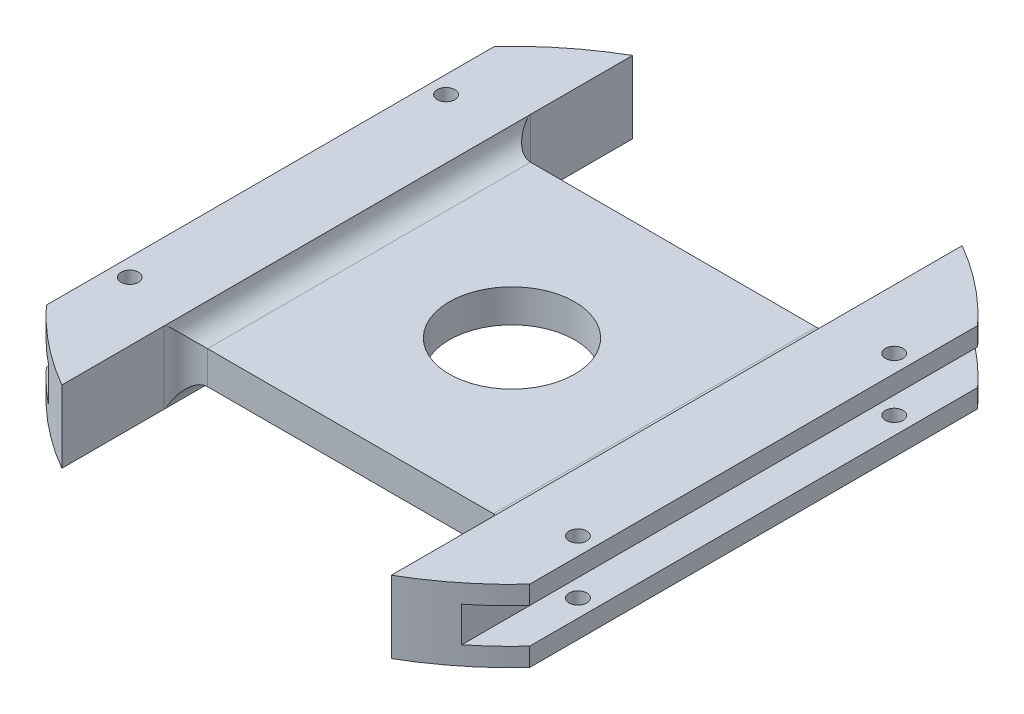
from build123d import *

# Parameters (mm, degrees)
SALIENTE_EXTRUIR1_DEPTH    = 100
CORTAR_EXTRUIR1_DEPTH      = 116.30370722574361
CORTAR_EXTRUIR1_DEPTH_BACK = 116.30370722574361
CROQUIS4_OUTSIDE_W         = 157.768
CROQUIS4_OUTSIDE_H         = 247.76800000000003
CROQUIS4_OUTSIDE_R         = 75.00000000000001
CORTAR_EXTRUIR2_DEPTH      = 95.44545992264534
CORTAR_EXTRUIR2_DEPTH_BACK = 95.44545992264534
CORTAR_EXTRUIR3_DEPTH      = 86.94714204090798
CORTAR_EXTRUIR3_DEPTH_BACK = 86.94714204090798
CROQUIS5_R                 = 14.27
REDONDEO1_R                = 5
CORTAR_EXTRUIR4_DEPTH      = 87.68157187826033
CORTAR_EXTRUIR4_DEPTH_BACK = 87.68157187826033
CORTAR_EXTRUIR5_DEPTH      = 86.98230182684696
CORTAR_EXTRUIR5_DEPTH_BACK = 86.98230182684696
CROQUIS8_R                 = 2.0000000000000036


with BuildPart() as part:
    # Croquis3 → Saliente-Extruir1 (new, symmetric)
    with BuildSketch(Plane.XY):
        Polygon((37.50000000000001, 4.465), (0, 4.465), (-37.50000000000001, 4.465), (-37.5, 0), (-54.99999999999999, 0), (-54.99999999999999, 6.5), (-54.99999999999999, 16.43), (-37.5, 16.43), (-37.50000000000001, 11.965), (0, 11.965), (37.50000000000001, 11.965), (37.5, 16.43), (54.99999999999999, 16.43), (54.99999999999999, 0), (37.5, 0), align=None)
    extrude(amount=SALIENTE_EXTRUIR1_DEPTH, both=True)

    # Croquis4 outside → Cortar-Extruir1 (cut, two sides: drawn at the far end of the back side and taken through both)
    with BuildSketch(Plane(origin=(0, 0, 0), x_dir=(1, 0, 0), z_dir=(0, 1, 0)).offset(-CORTAR_EXTRUIR1_DEPTH_BACK)):
        Rectangle(CROQUIS4_OUTSIDE_W, CROQUIS4_OUTSIDE_H)
        Circle(CROQUIS4_OUTSIDE_R, mode=Mode.SUBTRACT)
    extrude(amount=CORTAR_EXTRUIR1_DEPTH + CORTAR_EXTRUIR1_DEPTH_BACK, mode=Mode.SUBTRACT)

    # Croquis4<3> → Cortar-Extruir2 (cut, two sides: drawn at the far end of the back side and taken through both)
    with BuildSketch(Plane(origin=(0, 0, 0), x_dir=(1, 0, 0), z_dir=(0, 1, 0)).offset(-CORTAR_EXTRUIR2_DEPTH_BACK)):
        with BuildLine():
            ThreePointArc((37.500000000000966, 64.95190528383236), (1.17033e-12, 75.00000000000001), (-37.499999999998956, 64.95190528383351))
            Line((-37.50000000000001, 64.95190528383388), (-37.50000000000001, 36.752103032136134))
            Line((-37.50000000000001, 36.752103032136134), (37.50000000000001, 36.752103032136134))
            Line((37.50000000000001, 36.752103032136134), (37.50000000000001, 64.95190528383202))
        make_face()
        with BuildLine():
            Line((-37.50000000000001, -36.752103032136134), (-37.50000000000001, -64.95190528383385))
            ThreePointArc((-37.499999999999, -64.95190528383348), (1.18526e-12, -75.00000000000001), (37.50000000000099, -64.95190528383235))
            Line((37.50000000000001, -64.951905283832), (37.50000000000001, -36.752103032136134))
            Line((37.50000000000001, -36.752103032136134), (-37.50000000000001, -36.752103032136134))
        make_face()
    extrude(amount=CORTAR_EXTRUIR2_DEPTH + CORTAR_EXTRUIR2_DEPTH_BACK, mode=Mode.SUBTRACT)

    # Croquis5 → Cortar-Extruir3 (cut, two sides: drawn at the far end of the back side and taken through both)
    with BuildSketch(Plane(origin=(0, 11.965, 0), x_dir=(1, 0, 0), z_dir=(0, 1, 0)).offset(-CORTAR_EXTRUIR3_DEPTH_BACK)):
        with Locations(Location((0, 0, 0), (0, 0, 90))):
            Circle(CROQUIS5_R)
    extrude(amount=CORTAR_EXTRUIR3_DEPTH + CORTAR_EXTRUIR3_DEPTH_BACK, mode=Mode.SUBTRACT)

    # Redondeo1
    # the kernel refuses this fillet: 5 mm, written as the material it adds along each edge
    with BuildSketch(Plane(origin=(-37.50000000000001, 4.465, 36.752103032136134), x_dir=(1, 0, 0), z_dir=(0, 0, -1))) as redondeo1_piece_1:
        with BuildLine():
            CenterArc((4.971295102888192, 5), REDONDEO1_R, 186.14240739101976, 83.85759260898021)
            Line((1.421e-14, 4.465000000000001), (-0.09942590205774593, 4.454300000000001))
            ThreePointArc((-0.09942590205774593, 4.454300000000001), (-0.09999999999999432, 2.2325000000000004), (-0.10000000000000142, 0))
            Line((-0.10000000000000142, 0), (0, -0.09999999999999964))
            Line((0, -0.09999999999999964), (4.971295102888192, -0.09999999999999964))
            Line((4.971295102888192, -0.09999999999999964), (4.971295102888192, 0))
        make_face()
    extrude(amount=73.50420606427225)
    with BuildSketch(Plane(origin=(-37.50000000000001, 11.965, 36.752103032136134), x_dir=(1, 0, 0), z_dir=(0, 0, -1))) as redondeo1_piece_2:
        with BuildLine():
            CenterArc((4.971295102888185, -5), REDONDEO1_R, 90, 83.85759260898024)
            Line((7.11e-15, -4.465), (-0.09942590205775304, -4.4543))
            ThreePointArc((-0.09942590205775304, -4.4543), (-0.10000000000001563, -2.2325000000000017), (-0.10000000000000142, 0))
            Line((-0.10000000000000142, 0), (0, 0.09999999999999964))
            Line((0, 0.09999999999999964), (4.971295102888185, 0.09999999999999964))
            Line((4.971295102888185, 0.09999999999999964), (4.971295102888185, 0))
        make_face()
    extrude(amount=73.50420606427225)
    with BuildSketch(Plane(origin=(37.50000000000001, 11.965, 36.752103032136134), x_dir=(-3.18e-15, 1, 0), z_dir=(0, 0, -1))) as redondeo1_piece_3:
        with BuildLine():
            CenterArc((5.000000000000016, -4.971295102888176), REDONDEO1_R, 96.14240739101996, 83.85759260898021)
            Line((1.582e-14, -4.971295102888192), (-0.09999999999998382, -4.971295102888192))
            Line((-0.09999999999998382, -4.971295102888192), (-0.09999999999999964, -3.2e-16))
            Line((-0.09999999999999964, -3.2e-16), (-3.2e-16, 0.10000000000000142))
            ThreePointArc((-3.2e-16, 0.10000000000000142), (2.2324999999999995, 0.10000000000002274), (4.4543, 0.09942590205776011))
            Line((4.4543, 0.09942590205776011), (4.465, 0))
        make_face()
    extrude(amount=73.50420606427225)
    with BuildSketch(Plane(origin=(37.50000000000001, 4.465, -36.752103032136134), x_dir=(-1.59e-15, -1, 0), z_dir=(0, 0, 1))) as redondeo1_piece_4:
        with BuildLine():
            CenterArc((5.000000000000008, -4.971295102888177), REDONDEO1_R, 96.14240739101987, 83.85759260898021)
            Line((7.91e-15, -4.971295102888185), (-0.09999999999999173, -4.971295102888185))
            Line((-0.09999999999999173, -4.971295102888185), (-0.09999999999999964, -1.6e-16))
            Line((-0.09999999999999964, -1.6e-16), (-1.6e-16, 0.10000000000000142))
            ThreePointArc((-1.6e-16, 0.10000000000000142), (2.2325, 0.09999999999999787), (4.4543, 0.09942590205776013))
            Line((4.4543, 0.09942590205776013), (4.465, 0))
        make_face()
    extrude(amount=73.50420606427225)
    with BuildSketch(Plane(origin=(37.50000000000001, 4.465000000000003, -36.752103032136134), x_dir=(0, 0, -1), z_dir=(0, 1, 0)), Plane(origin=(-37.50000000000001, 4.465000000000003, -36.752103032136134), x_dir=(1, 0, 0), z_dir=(0, 1, 0)), Plane(origin=(-37.50000000000001, 11.965000000000003, 36.752103032136134), x_dir=(1, 0, 0), z_dir=(0, -1, 0))) as redondeo1_piece_5:
        with BuildLine():
            CenterArc((REDONDEO1_R, REDONDEO1_R), REDONDEO1_R, 180, 90)
            Line((0, REDONDEO1_R), (-REDONDEO1_R * 0.02, REDONDEO1_R))
            Line((-REDONDEO1_R * 0.02, REDONDEO1_R), (-REDONDEO1_R * 0.02, -REDONDEO1_R * 0.02))
            Line((-REDONDEO1_R * 0.02, -REDONDEO1_R * 0.02), (REDONDEO1_R, -REDONDEO1_R * 0.02))
            Line((REDONDEO1_R, -REDONDEO1_R * 0.02), (REDONDEO1_R, 0))
        make_face()
    extrude(amount=7.5)
    with BuildSketch(Plane(origin=(37.50000000000001, 4.465000000000003, 36.752103032136134), x_dir=(0, 0, 1), z_dir=(0, 1, 0))) as redondeo1_piece_6:
        with BuildLine():
            CenterArc((REDONDEO1_R, -REDONDEO1_R), REDONDEO1_R, 90, 90)
            Line((0, -REDONDEO1_R), (-REDONDEO1_R * 0.02, -REDONDEO1_R))
            Line((-REDONDEO1_R * 0.02, -REDONDEO1_R), (-REDONDEO1_R * 0.02, REDONDEO1_R * 0.02))
            Line((-REDONDEO1_R * 0.02, REDONDEO1_R * 0.02), (REDONDEO1_R, REDONDEO1_R * 0.02))
            Line((REDONDEO1_R, REDONDEO1_R * 0.02), (REDONDEO1_R, 0))
        make_face()
    extrude(amount=7.5)
    with BuildSketch(Plane(origin=(-37.50000000000001, 4.465, 49.18034078935661), x_dir=(1, 0, 0), z_dir=(0, 0, -1))) as redondeo1_piece_7a_section:
        with BuildLine():
            CenterArc((4.971295102888192, 5), REDONDEO1_R, 186.14240739101976, 83.85759260898021)
            Line((1.421e-14, 4.465000000000001), (-0.09942590205774593, 4.454300000000001))
            ThreePointArc((-0.09942590205774593, 4.454300000000001), (-0.09999999999999432, 2.2325000000000004), (-0.10000000000000142, 0))
            Line((-0.10000000000000142, 0), (0, -0.09999999999999964))
            Line((0, -0.09999999999999964), (4.971295102888192, -0.09999999999999964))
            Line((4.971295102888192, -0.09999999999999964), (4.971295102888192, 0))
        make_face()
    redondeo1_piece_7a = extrude(amount=85.93244382149274, mode=Mode.PRIVATE)
    redondeo1_piece_7a = split(redondeo1_piece_7a, bisect_by=Plane(origin=(-36.3586151753133, 3.3888910870281705, 36.752103032136134), z_dir=(0, 0, 1)), keep=Keep.TOP, mode=Mode.PRIVATE)
    with BuildSketch(Plane(origin=(-37.50000000000001, 11.965000000000003, 36.752103032136134), x_dir=(1, 0, 0), z_dir=(0, -1, 0))) as redondeo1_piece_7b_section:
        with BuildLine():
            CenterArc((REDONDEO1_R, REDONDEO1_R), REDONDEO1_R, 180, 90)
            Line((0, REDONDEO1_R), (-REDONDEO1_R * 0.02, REDONDEO1_R))
            Line((-REDONDEO1_R * 0.02, REDONDEO1_R), (-REDONDEO1_R * 0.02, -REDONDEO1_R * 0.02))
            Line((-REDONDEO1_R * 0.02, -REDONDEO1_R * 0.02), (REDONDEO1_R, -REDONDEO1_R * 0.02))
            Line((REDONDEO1_R, -REDONDEO1_R * 0.02), (REDONDEO1_R, 0))
        make_face()
    redondeo1_piece_7b = extrude(amount=20, mode=Mode.PRIVATE)
    redondeo1_piece_7b = split(redondeo1_piece_7b, bisect_by=Plane(origin=(-36.3680244286659, 4.465, 37.884078603470265), z_dir=(0, -1, 0)), keep=Keep.TOP, mode=Mode.PRIVATE)
    redondeo1_piece_7b = split(redondeo1_piece_7b, bisect_by=Plane(origin=(-36.368024428665905, 0, 37.884078603470265), z_dir=(0, 1, 0)), keep=Keep.TOP, mode=Mode.PRIVATE)
    redondeo1_piece_7 = redondeo1_piece_7a & redondeo1_piece_7b
    add(redondeo1_piece_7)
    with BuildSketch(Plane(origin=(-37.50000000000001, 4.465, 36.752103032136134), x_dir=(1, 0, 0), z_dir=(0, 0, -1))) as redondeo1_piece_8a_section:
        with BuildLine():
            CenterArc((4.971295102888192, 5), REDONDEO1_R, 186.14240739101976, 83.85759260898021)
            Line((1.421e-14, 4.465000000000001), (-0.09942590205774593, 4.454300000000001))
            ThreePointArc((-0.09942590205774593, 4.454300000000001), (-0.09999999999999432, 2.2325000000000004), (-0.10000000000000142, 0))
            Line((-0.10000000000000142, 0), (0, -0.09999999999999964))
            Line((0, -0.09999999999999964), (4.971295102888192, -0.09999999999999964))
            Line((4.971295102888192, -0.09999999999999964), (4.971295102888192, 0))
        make_face()
    redondeo1_piece_8a = extrude(amount=85.93244382149273, mode=Mode.PRIVATE)
    redondeo1_piece_8a = split(redondeo1_piece_8a, bisect_by=Plane(origin=(-36.35861517531315, 3.3888910870273232, -36.752103032136134), z_dir=(0, 0, -1)), keep=Keep.TOP, mode=Mode.PRIVATE)
    with BuildSketch(Plane(origin=(-37.499999999999986, -8.034999999999997, -36.752103032136134), x_dir=(1, 0, 0), z_dir=(0, 1, 0))) as redondeo1_piece_8b_section:
        with BuildLine():
            CenterArc((REDONDEO1_R, REDONDEO1_R), REDONDEO1_R, 180, 90)
            Line((0, REDONDEO1_R), (-REDONDEO1_R * 0.02, REDONDEO1_R))
            Line((-REDONDEO1_R * 0.02, REDONDEO1_R), (-REDONDEO1_R * 0.02, -REDONDEO1_R * 0.02))
            Line((-REDONDEO1_R * 0.02, -REDONDEO1_R * 0.02), (REDONDEO1_R, -REDONDEO1_R * 0.02))
            Line((REDONDEO1_R, -REDONDEO1_R * 0.02), (REDONDEO1_R, 0))
        make_face()
    redondeo1_piece_8b = extrude(amount=20, mode=Mode.PRIVATE)
    redondeo1_piece_8b = split(redondeo1_piece_8b, bisect_by=Plane(origin=(-36.36802442866587, 4.465, -37.884078603470265), z_dir=(0, -1, 0)), keep=Keep.TOP, mode=Mode.PRIVATE)
    redondeo1_piece_8b = split(redondeo1_piece_8b, bisect_by=Plane(origin=(-36.36802442866587, 0, -37.884078603470265), z_dir=(0, 1, 0)), keep=Keep.TOP, mode=Mode.PRIVATE)
    redondeo1_piece_8 = redondeo1_piece_8a & redondeo1_piece_8b
    add(redondeo1_piece_8)
    with BuildSketch(Plane(origin=(-37.500000000000036, 24.465000000000003, 36.752103032136134), x_dir=(1, 0, 0), z_dir=(0, -1, 0))) as redondeo1_piece_9a_section:
        with BuildLine():
            CenterArc((REDONDEO1_R, REDONDEO1_R), REDONDEO1_R, 180, 90)
            Line((0, REDONDEO1_R), (-REDONDEO1_R * 0.02, REDONDEO1_R))
            Line((-REDONDEO1_R * 0.02, REDONDEO1_R), (-REDONDEO1_R * 0.02, -REDONDEO1_R * 0.02))
            Line((-REDONDEO1_R * 0.02, -REDONDEO1_R * 0.02), (REDONDEO1_R, -REDONDEO1_R * 0.02))
            Line((REDONDEO1_R, -REDONDEO1_R * 0.02), (REDONDEO1_R, 0))
        make_face()
    redondeo1_piece_9a = extrude(amount=20, mode=Mode.PRIVATE)
    redondeo1_piece_9a = split(redondeo1_piece_9a, bisect_by=Plane(origin=(-36.36802442866591, 11.965, 37.884078603470265), z_dir=(0, 1, 0)), keep=Keep.TOP, mode=Mode.PRIVATE)
    redondeo1_piece_9a = split(redondeo1_piece_9a, bisect_by=Plane(origin=(-36.36802442866591, 16.43, 37.884078603470265), z_dir=(0, -1, 0)), keep=Keep.TOP, mode=Mode.PRIVATE)
    with BuildSketch(Plane(origin=(-37.50000000000002, 11.965, 49.18034078935659), x_dir=(1, 0, 0), z_dir=(0, 0, -1))) as redondeo1_piece_9b_section:
        with BuildLine():
            CenterArc((4.971295102888199, -5), REDONDEO1_R, 90, 83.85759260898024)
            Line((2.132e-14, -4.465), (-0.09942590205773882, -4.4543))
            ThreePointArc((-0.09942590205773882, -4.4543), (-0.10000000000000142, -2.2325000000000017), (-0.10000000000000142, 0))
            Line((-0.10000000000000142, 0), (0, 0.09999999999999964))
            Line((0, 0.09999999999999964), (4.971295102888199, 0.09999999999999964))
            Line((4.971295102888199, 0.09999999999999964), (4.971295102888199, 0))
        make_face()
    redondeo1_piece_9b = extrude(amount=85.93244382149271, mode=Mode.PRIVATE)
    redondeo1_piece_9b = split(redondeo1_piece_9b, bisect_by=Plane(origin=(-36.35861517531264, 13.04110891296965, 36.752103032136134), z_dir=(0, 0, 1)), keep=Keep.TOP, mode=Mode.PRIVATE)
    redondeo1_piece_9 = redondeo1_piece_9a & redondeo1_piece_9b
    add(redondeo1_piece_9)
    with BuildSketch(Plane(origin=(-37.50000000000001, 11.965, 36.752103032136134), x_dir=(1, 0, 0), z_dir=(0, 0, -1))) as redondeo1_piece_10a_section:
        with BuildLine():
            CenterArc((4.971295102888185, -5), REDONDEO1_R, 90, 83.85759260898024)
            Line((7.11e-15, -4.465), (-0.09942590205775304, -4.4543))
            ThreePointArc((-0.09942590205775304, -4.4543), (-0.10000000000001563, -2.2325000000000017), (-0.10000000000000142, 0))
            Line((-0.10000000000000142, 0), (0, 0.09999999999999964))
            Line((0, 0.09999999999999964), (4.971295102888185, 0.09999999999999964))
            Line((4.971295102888185, 0.09999999999999964), (4.971295102888185, 0))
        make_face()
    redondeo1_piece_10a = extrude(amount=85.93244382149273, mode=Mode.PRIVATE)
    redondeo1_piece_10a = split(redondeo1_piece_10a, bisect_by=Plane(origin=(-36.35861517531267, 13.041108912969635, -36.752103032136134), z_dir=(0, 0, -1)), keep=Keep.TOP, mode=Mode.PRIVATE)
    with BuildSketch(Plane(origin=(-37.50000000000001, 4.465000000000003, -36.752103032136134), x_dir=(1, 0, 0), z_dir=(0, 1, 0))) as redondeo1_piece_10b_section:
        with BuildLine():
            CenterArc((REDONDEO1_R, REDONDEO1_R), REDONDEO1_R, 180, 90)
            Line((0, REDONDEO1_R), (-REDONDEO1_R * 0.02, REDONDEO1_R))
            Line((-REDONDEO1_R * 0.02, REDONDEO1_R), (-REDONDEO1_R * 0.02, -REDONDEO1_R * 0.02))
            Line((-REDONDEO1_R * 0.02, -REDONDEO1_R * 0.02), (REDONDEO1_R, -REDONDEO1_R * 0.02))
            Line((REDONDEO1_R, -REDONDEO1_R * 0.02), (REDONDEO1_R, 0))
        make_face()
    redondeo1_piece_10b = extrude(amount=20, mode=Mode.PRIVATE)
    redondeo1_piece_10b = split(redondeo1_piece_10b, bisect_by=Plane(origin=(-36.36802442866587, 11.965, -37.88407860347027), z_dir=(0, 1, 0)), keep=Keep.TOP, mode=Mode.PRIVATE)
    redondeo1_piece_10b = split(redondeo1_piece_10b, bisect_by=Plane(origin=(-36.36802442866587, 16.43, -37.88407860347027), z_dir=(0, -1, 0)), keep=Keep.TOP, mode=Mode.PRIVATE)
    redondeo1_piece_10 = redondeo1_piece_10a & redondeo1_piece_10b
    add(redondeo1_piece_10)
    with BuildSketch(Plane(origin=(37.50000000000001, 4.465000000000003, 36.752103032136134), x_dir=(0, 0, 1), z_dir=(0, 1, 0))) as redondeo1_piece_11a_section:
        with BuildLine():
            CenterArc((REDONDEO1_R, -REDONDEO1_R), REDONDEO1_R, 90, 90)
            Line((0, -REDONDEO1_R), (-REDONDEO1_R * 0.02, -REDONDEO1_R))
            Line((-REDONDEO1_R * 0.02, -REDONDEO1_R), (-REDONDEO1_R * 0.02, REDONDEO1_R * 0.02))
            Line((-REDONDEO1_R * 0.02, REDONDEO1_R * 0.02), (REDONDEO1_R, REDONDEO1_R * 0.02))
            Line((REDONDEO1_R, REDONDEO1_R * 0.02), (REDONDEO1_R, 0))
        make_face()
    redondeo1_piece_11a = extrude(amount=20, mode=Mode.PRIVATE)
    redondeo1_piece_11a = split(redondeo1_piece_11a, bisect_by=Plane(origin=(36.36802442866585, 16.43, 37.88407860347026), z_dir=(0, -1, 0)), keep=Keep.TOP, mode=Mode.PRIVATE)
    redondeo1_piece_11a = split(redondeo1_piece_11a, bisect_by=Plane(origin=(36.36802442866584, 11.965, 37.88407860347026), z_dir=(0, 1, 0)), keep=Keep.TOP, mode=Mode.PRIVATE)
    with BuildSketch(Plane(origin=(37.50000000000002, 11.965, 49.18034078935661), x_dir=(-6.37e-15, 1, 0), z_dir=(0, 0, -1))) as redondeo1_piece_11b_section:
        with BuildLine():
            CenterArc((5.000000000000032, -4.971295102888174), REDONDEO1_R, 96.14240739102014, 83.85759260898021)
            Line((3.164e-14, -4.971295102888206), (-0.099999999999968, -4.971295102888207))
            Line((-0.099999999999968, -4.971295102888207), (-0.09999999999999964, -6.4e-16))
            Line((-0.09999999999999964, -6.4e-16), (-6.4e-16, 0.10000000000000142))
            ThreePointArc((-6.4e-16, 0.10000000000000142), (2.2324999999999995, 0.10000000000001563), (4.454299999999999, 0.09942590205776007))
            Line((4.454299999999999, 0.09942590205776007), (4.465, 0))
        make_face()
    redondeo1_piece_11b = extrude(amount=85.93244382149274, mode=Mode.PRIVATE)
    redondeo1_piece_11b = split(redondeo1_piece_11b, bisect_by=Plane(origin=(36.35861517531313, 13.041108912972746, 36.752103032136134), z_dir=(0, 0, 1)), keep=Keep.TOP, mode=Mode.PRIVATE)
    redondeo1_piece_11 = redondeo1_piece_11a & redondeo1_piece_11b
    add(redondeo1_piece_11)
    with BuildSketch(Plane(origin=(37.50000000000001, 11.965, 36.752103032136134), x_dir=(-3.18e-15, 1, 0), z_dir=(0, 0, -1))) as redondeo1_piece_12a_section:
        with BuildLine():
            CenterArc((5.000000000000016, -4.971295102888176), REDONDEO1_R, 96.14240739101996, 83.85759260898021)
            Line((1.582e-14, -4.971295102888192), (-0.09999999999998382, -4.971295102888192))
            Line((-0.09999999999998382, -4.971295102888192), (-0.09999999999999964, -3.2e-16))
            Line((-0.09999999999999964, -3.2e-16), (-3.2e-16, 0.10000000000000142))
            ThreePointArc((-3.2e-16, 0.10000000000000142), (2.2324999999999995, 0.10000000000002274), (4.4543, 0.09942590205776011))
            Line((4.4543, 0.09942590205776011), (4.465, 0))
        make_face()
    redondeo1_piece_12a = extrude(amount=85.93244382149273, mode=Mode.PRIVATE)
    redondeo1_piece_12a = split(redondeo1_piece_12a, bisect_by=Plane(origin=(36.35861517531357, 13.04110891297261, -36.752103032136134), z_dir=(0, 0, -1)), keep=Keep.TOP, mode=Mode.PRIVATE)
    with BuildSketch(Plane(origin=(37.50000000000001, 4.465000000000003, -36.752103032136134), x_dir=(0, 0, -1), z_dir=(0, 1, 0))) as redondeo1_piece_12b_section:
        with BuildLine():
            CenterArc((REDONDEO1_R, REDONDEO1_R), REDONDEO1_R, 180, 90)
            Line((0, REDONDEO1_R), (-REDONDEO1_R * 0.02, REDONDEO1_R))
            Line((-REDONDEO1_R * 0.02, REDONDEO1_R), (-REDONDEO1_R * 0.02, -REDONDEO1_R * 0.02))
            Line((-REDONDEO1_R * 0.02, -REDONDEO1_R * 0.02), (REDONDEO1_R, -REDONDEO1_R * 0.02))
            Line((REDONDEO1_R, -REDONDEO1_R * 0.02), (REDONDEO1_R, 0))
        make_face()
    redondeo1_piece_12b = extrude(amount=20, mode=Mode.PRIVATE)
    redondeo1_piece_12b = split(redondeo1_piece_12b, bisect_by=Plane(origin=(36.36802442866586, 16.43, -37.88407860347026), z_dir=(0, -1, 0)), keep=Keep.TOP, mode=Mode.PRIVATE)
    redondeo1_piece_12b = split(redondeo1_piece_12b, bisect_by=Plane(origin=(36.36802442866587, 11.965, -37.88407860347026), z_dir=(0, 1, 0)), keep=Keep.TOP, mode=Mode.PRIVATE)
    redondeo1_piece_12 = redondeo1_piece_12a & redondeo1_piece_12b
    add(redondeo1_piece_12)
    with BuildSketch(Plane(origin=(37.50000000000001, 4.465, -49.18034078935659), x_dir=(-1.59e-15, -1, 0), z_dir=(0, 0, 1))) as redondeo1_piece_13a_section:
        with BuildLine():
            CenterArc((5.000000000000008, -4.971295102888177), REDONDEO1_R, 96.14240739101987, 83.85759260898021)
            Line((7.91e-15, -4.971295102888185), (-0.09999999999999173, -4.971295102888185))
            Line((-0.09999999999999173, -4.971295102888185), (-0.09999999999999964, -1.6e-16))
            Line((-0.09999999999999964, -1.6e-16), (-1.6e-16, 0.10000000000000142))
            ThreePointArc((-1.6e-16, 0.10000000000000142), (2.2325, 0.09999999999999787), (4.4543, 0.09942590205776013))
            Line((4.4543, 0.09942590205776013), (4.465, 0))
        make_face()
    redondeo1_piece_13a = extrude(amount=85.93244382149271, mode=Mode.PRIVATE)
    redondeo1_piece_13a = split(redondeo1_piece_13a, bisect_by=Plane(origin=(36.35861517531293, 3.38889108702688, -36.752103032136134), z_dir=(0, 0, -1)), keep=Keep.TOP, mode=Mode.PRIVATE)
    with BuildSketch(Plane(origin=(37.499999999999986, -8.034999999999997, -36.752103032136134), x_dir=(0, 0, -1), z_dir=(0, 1, 0))) as redondeo1_piece_13b_section:
        with BuildLine():
            CenterArc((REDONDEO1_R, REDONDEO1_R), REDONDEO1_R, 180.00000000000009, 89.99999999999989)
            Line((0, REDONDEO1_R), (-REDONDEO1_R * 0.02, REDONDEO1_R))
            Line((-REDONDEO1_R * 0.02, REDONDEO1_R), (-REDONDEO1_R * 0.02, -REDONDEO1_R * 0.02))
            Line((-REDONDEO1_R * 0.02, -REDONDEO1_R * 0.02), (REDONDEO1_R, -REDONDEO1_R * 0.02))
            Line((REDONDEO1_R, -REDONDEO1_R * 0.02), (REDONDEO1_R, 0))
        make_face()
    redondeo1_piece_13b = extrude(amount=20, mode=Mode.PRIVATE)
    redondeo1_piece_13b = split(redondeo1_piece_13b, bisect_by=Plane(origin=(36.368024428665855, 0, -37.88407860347026), z_dir=(0, 1, 0)), keep=Keep.TOP, mode=Mode.PRIVATE)
    redondeo1_piece_13b = split(redondeo1_piece_13b, bisect_by=Plane(origin=(36.368024428665855, 4.465, -37.88407860347026), z_dir=(0, -1, 0)), keep=Keep.TOP, mode=Mode.PRIVATE)
    redondeo1_piece_13 = redondeo1_piece_13a & redondeo1_piece_13b
    add(redondeo1_piece_13)
    with BuildSketch(Plane(origin=(37.50000000000001, 4.465, -36.752103032136134), x_dir=(-1.59e-15, -1, 0), z_dir=(0, 0, 1))) as redondeo1_piece_14a_section:
        with BuildLine():
            CenterArc((5.000000000000008, -4.971295102888177), REDONDEO1_R, 96.14240739101987, 83.85759260898021)
            Line((7.91e-15, -4.971295102888185), (-0.09999999999999173, -4.971295102888185))
            Line((-0.09999999999999173, -4.971295102888185), (-0.09999999999999964, -1.6e-16))
            Line((-0.09999999999999964, -1.6e-16), (-1.6e-16, 0.10000000000000142))
            ThreePointArc((-1.6e-16, 0.10000000000000142), (2.2325, 0.09999999999999787), (4.4543, 0.09942590205776013))
            Line((4.4543, 0.09942590205776013), (4.465, 0))
        make_face()
    redondeo1_piece_14a = extrude(amount=85.93244382149273, mode=Mode.PRIVATE)
    redondeo1_piece_14a = split(redondeo1_piece_14a, bisect_by=Plane(origin=(36.35861517531297, 3.3888910870269298, 36.752103032136134), z_dir=(0, 0, 1)), keep=Keep.TOP, mode=Mode.PRIVATE)
    with BuildSketch(Plane(origin=(37.499999999999986, -8.034999999999997, 36.752103032136134), x_dir=(0, 0, 1), z_dir=(0, 1, 0))) as redondeo1_piece_14b_section:
        with BuildLine():
            CenterArc((REDONDEO1_R, -REDONDEO1_R), REDONDEO1_R, 90, 90)
            Line((0, -REDONDEO1_R), (-REDONDEO1_R * 0.02, -REDONDEO1_R))
            Line((-REDONDEO1_R * 0.02, -REDONDEO1_R), (-REDONDEO1_R * 0.02, REDONDEO1_R * 0.02))
            Line((-REDONDEO1_R * 0.02, REDONDEO1_R * 0.02), (REDONDEO1_R, REDONDEO1_R * 0.02))
            Line((REDONDEO1_R, REDONDEO1_R * 0.02), (REDONDEO1_R, 0))
        make_face()
    redondeo1_piece_14b = extrude(amount=20, mode=Mode.PRIVATE)
    redondeo1_piece_14b = split(redondeo1_piece_14b, bisect_by=Plane(origin=(36.36802442866586, 0, 37.88407860347026), z_dir=(0, 1, 0)), keep=Keep.TOP, mode=Mode.PRIVATE)
    redondeo1_piece_14b = split(redondeo1_piece_14b, bisect_by=Plane(origin=(36.36802442866586, 4.465, 37.88407860347026), z_dir=(0, -1, 0)), keep=Keep.TOP, mode=Mode.PRIVATE)
    redondeo1_piece_14 = redondeo1_piece_14a & redondeo1_piece_14b
    add(redondeo1_piece_14)

    # Croquis7 → Cortar-Extruir4 (cut, two sides: drawn at the far end of the back side and taken through both)
    with BuildSketch(Plane.XY.offset(-CORTAR_EXTRUIR4_DEPTH_BACK)):
        Polygon((-54.99999999999999, 12.214999999999998), (-46.99999999999999, 12.215000000000003), (-46.99999999999999, 4.215000000000002), (-54.99999999999999, 4.215000000000002), align=None)
        Polygon((46.99999999999999, 12.215000000000003), (46.99999999999999, 4.215000000000002), (54.99999999999999, 4.215000000000002), (54.99999999999999, 12.214999999999998), align=None)
    extrude(amount=CORTAR_EXTRUIR4_DEPTH + CORTAR_EXTRUIR4_DEPTH_BACK, mode=Mode.SUBTRACT)

    # Croquis8 → Cortar-Extruir5 (cut, two sides: drawn at the far end of the back side and taken through both)
    with BuildSketch(Plane(origin=(0, 4.215000000000002, 0), x_dir=(1, 0, 0), z_dir=(0, 1, 0)).offset(-CORTAR_EXTRUIR5_DEPTH_BACK)):
        with Locations(Location((-50.99999999999999, 35.99019513592787, 0), (0, 0, 270))):
            Circle(CROQUIS8_R)
        with Locations(Location((-50.99999999999999, -35.99019513592787, 0), (0, 0, 270))):
            Circle(CROQUIS8_R)
        with Locations((50.99999999999999, -35.99019513592787)):
            Circle(CROQUIS8_R)
        with Locations((50.99999999999999, 35.99019513592787)):
            Circle(CROQUIS8_R)
    extrude(amount=CORTAR_EXTRUIR5_DEPTH + CORTAR_EXTRUIR5_DEPTH_BACK, mode=Mode.SUBTRACT)


solid = part.part
